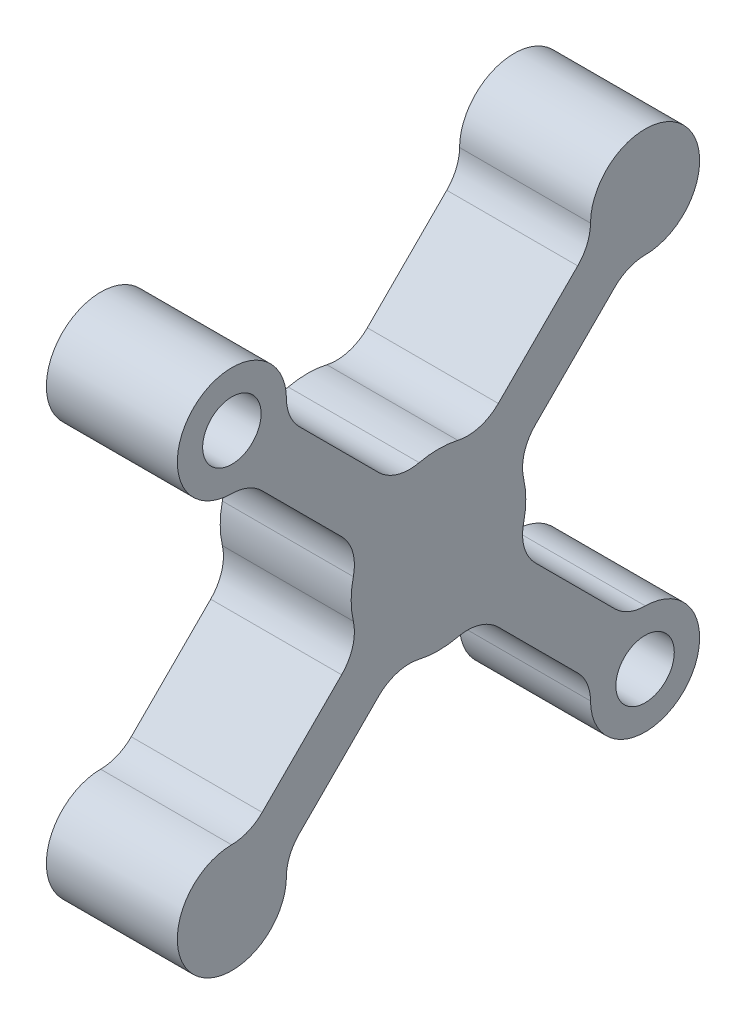
from build123d import *

# Parameters (mm, degrees)
BOSS_EXTRUDE1_DEPTH  = 7.62
M3_CLEARANCE_HOLE1_D = 3.4


with BuildPart() as part:
    # Sketch2 → Boss-Extrude1 (new body)
    with BuildSketch(Plane.YZ):
        with BuildLine():
            Line((-3.48023631, 5.63549778), (-8.101958691, 10.25722016))
            ThreePointArc((-8.101958691, 10.25722016), (-8.649791918, 11.074595912), (-8.845866506, 12.038846461))
            ThreePointArc((-8.845866506, 12.038846461), (-14.265879336, 14.265879336), (-12.038846461, 8.845866506))
            ThreePointArc((-12.038846461, 8.845866506), (-11.074595912, 8.649791918), (-10.25722016, 8.101958691))
            Line((-10.25722016, 8.101958691), (-5.63549778, 3.48023631))
            ThreePointArc((-5.63549778, 3.48023631), (-4.991360303, 2.389223457), (-4.954366003, 1.122790058))
            ThreePointArc((-4.954366003, 1.122790058), (-5.08, 0), (-4.954366003, -1.122790058))
            ThreePointArc((-4.954366003, -1.122790058), (-4.991360303, -2.389223457), (-5.63549778, -3.48023631))
            Line((-5.63549778, -3.48023631), (-10.25722016, -8.101958691))
            ThreePointArc((-10.25722016, -8.101958691), (-11.074595912, -8.649791918), (-12.038846461, -8.845866506))
            ThreePointArc((-12.038846461, -8.845866506), (-14.265879336, -14.265879336), (-8.845866506, -12.038846461))
            ThreePointArc((-8.845866506, -12.038846461), (-8.649791918, -11.074595912), (-8.101958691, -10.25722016))
            Line((-8.101958691, -10.25722016), (-3.48023631, -5.63549778))
            ThreePointArc((-3.48023631, -5.63549778), (-2.389223457, -4.991360303), (-1.122790058, -4.954366003))
            ThreePointArc((-1.122790058, -4.954366003), (0, -5.08), (1.122790058, -4.954366003))
            ThreePointArc((1.122790058, -4.954366003), (2.389223457, -4.991360303), (3.48023631, -5.63549778))
            Line((3.48023631, -5.63549778), (8.101958691, -10.25722016))
            ThreePointArc((8.101958691, -10.25722016), (8.649791918, -11.074595912), (8.845866506, -12.038846461))
            ThreePointArc((8.845866506, -12.038846461), (14.265879336, -14.265879336), (12.038846461, -8.845866506))
            ThreePointArc((12.038846461, -8.845866506), (11.074595912, -8.649791918), (10.25722016, -8.101958691))
            Line((10.25722016, -8.101958691), (5.63549778, -3.48023631))
            ThreePointArc((5.63549778, -3.48023631), (4.991360303, -2.389223457), (4.954366003, -1.122790058))
            ThreePointArc((4.954366003, -1.122790058), (5.08, 0), (4.954366003, 1.122790058))
            ThreePointArc((4.954366003, 1.122790058), (4.991360303, 2.389223457), (5.63549778, 3.48023631))
            Line((5.63549778, 3.48023631), (10.25722016, 8.101958691))
            ThreePointArc((10.25722016, 8.101958691), (11.074595912, 8.649791918), (12.038846461, 8.845866506))
            ThreePointArc((12.038846461, 8.845866506), (14.265879336, 14.265879336), (8.845866506, 12.038846461))
            ThreePointArc((8.845866506, 12.038846461), (8.649791918, 11.074595912), (8.101958691, 10.25722016))
            Line((8.101958691, 10.25722016), (3.48023631, 5.63549778))
            ThreePointArc((3.48023631, 5.63549778), (2.389223457, 4.991360303), (1.122790058, 4.954366003))
            ThreePointArc((1.122790058, 4.954366003), (0, 5.08), (-1.122790058, 4.954366003))
            ThreePointArc((-1.122790058, 4.954366003), (-2.389223457, 4.991360303), (-3.48023631, 5.63549778))
        make_face()
    extrude(amount=BOSS_EXTRUDE1_DEPTH)

    # M3 Clearance Hole1 (through all)
    with Locations(Plane(origin=(7.62, 0, 0), x_dir=(0, 0, -1), z_dir=(1, 0, 0))):
        with Locations((-12.020815306, 12.020815306), (12.020815306, -12.020815306)):
            Hole(M3_CLEARANCE_HOLE1_D / 2)


solid = part.part
